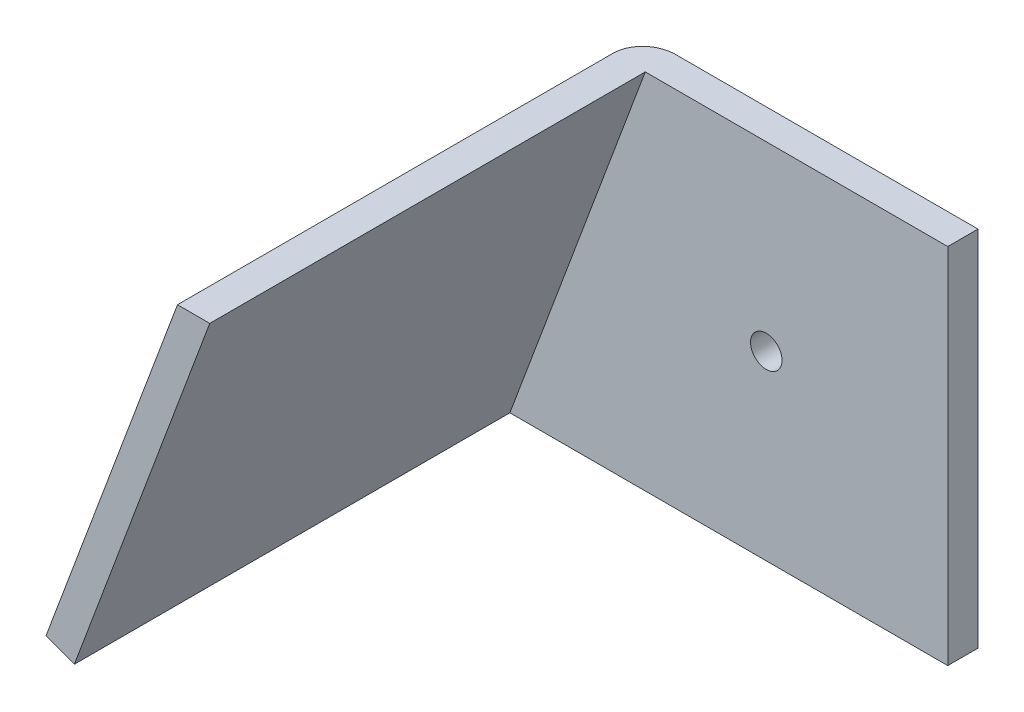
from build123d import *

# Parameters (mm, degrees)
SKETCH13_R              = 1.651
BASE_FLANGE5_DEPTH      = 3.175
EDGE_FLANGE4_START      = -51.763631849
EDGE_FLANGE4_DEPTH      = 40.665312179
CUT_EXTRUDE4_DEPTH      = 53.975
CUT_EXTRUDE4_DEPTH_BACK = 5.588


# Read off the part's stored shape, not the designer's step: Edge-Flange4
# Sheet-metal steps are written as plain solids
with BuildPart() as part:
    # Sketch13 → Base-Flange5 (new body)
    with BuildSketch(Plane.XY):
        Polygon((-31.75, 0), (0, 0), (0, -38.1), (-45.964697135, -38.1), align=None)
        with Locations((-19.05, -19.05)):
            Circle(SKETCH13_R, mode=Mode.SUBTRACT)
    extrude(amount=-BASE_FLANGE5_DEPTH)

    # Edge-Flange4 outline → Edge-Flange4 (add)
    with BuildSketch(Plane(origin=(0, 0, 0), x_dir=(0.9369164518419233, -0.34955337542060905, 0), z_dir=(0.34955337542060905, 0.9369164518419232, 0)).offset(EDGE_FLANGE4_START)):
        with BuildLine():
            Line((-29.747097346, -45.72), (-29.747097346, 3.175))
            ThreePointArc((-29.747097346, 3.175), (-31.992161376, 2.24506403), (-32.922097346, 0))
            Line((-32.922097346, 0), (-32.922097346, -45.72))
            Line((-32.922097346, -45.72), (-29.747097346, -45.72))
        make_face()
    extrude(amount=EDGE_FLANGE4_DEPTH)

    # Sketch51 → Cut-Extrude4 (cut, two sides: drawn at the far end of the back side and taken through both)
    with BuildSketch(Plane.XY.offset(-CUT_EXTRUDE4_DEPTH_BACK)):
        Polygon((-31.75, 0), (-35.138776015, 0), (-34.724709735, 1.109831967), align=None)
    extrude(amount=CUT_EXTRUDE4_DEPTH + CUT_EXTRUDE4_DEPTH_BACK, mode=Mode.SUBTRACT)


solid = part.part
